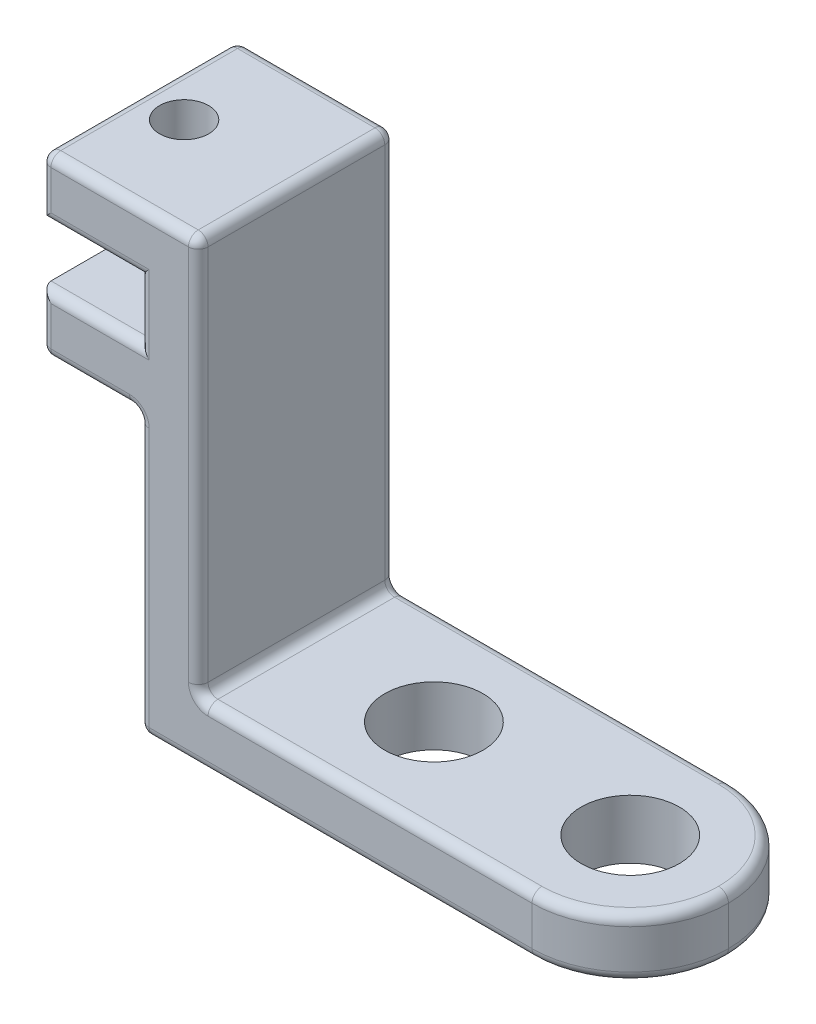
from build123d import *

# Parameters (mm, degrees)
BOSS_EXTRUDE1_DEPTH = 10
SKETCH2_R           = 1.25
CUT_EXTRUDE1_DEPTH  = 40.220402854
CUT_EXTRUDE2_REACH  = 39.524
SKETCH3_R           = 2.5
FILLET1_R           = 0.5
FILLET2_R           = 5


with BuildPart() as part:
    # Sketch1 → Boss-Extrude1 (new body)
    with BuildSketch(Plane.XY):
        Polygon((0, 0), (8, 0), (8, -20.2), (30, -20.2), (30, -23.2), (5, -23.2), (5, -9), (0, -9), (0, -6), (5, -6), (5, -3), (0, -3), align=None)
    extrude(amount=BOSS_EXTRUDE1_DEPTH)

    # Sketch2 → Cut-Extrude1 (cut, through all)
    with BuildSketch(Plane(origin=(0, 0, 0), x_dir=(1, 0, 0), z_dir=(0, 1, 0))):
        with Locations(Location((2.28, -5, 0), (0, 0, 270))):
            Circle(SKETCH2_R)
    extrude(amount=-CUT_EXTRUDE1_DEPTH, mode=Mode.SUBTRACT)

    # Sketch3 → Cut-Extrude2 (cut, up to next)
    with BuildSketch(Plane(origin=(0, -20.2, 0), x_dir=(1, 0, 0), z_dir=(0, 1, 0)), mode=Mode.PRIVATE) as cut_extrude2_sk1:
        with Locations(Location((25, -5, 0), (0, 0, 270))):
            Circle(SKETCH3_R)
    cut_extrude2_tool1 = extrude(cut_extrude2_sk1.sketch, amount=-CUT_EXTRUDE2_REACH, mode=Mode.PRIVATE) & part.part
    # Sketch3 → Cut-Extrude2 (cut, up to next)
    with BuildSketch(Plane(origin=(0, -20.2, 0), x_dir=(1, 0, 0), z_dir=(0, 1, 0)), mode=Mode.PRIVATE) as cut_extrude2_sk2:
        with Locations(Location((15, -5, 0), (0, 0, 270))):
            Circle(SKETCH3_R)
    cut_extrude2_tool2 = extrude(cut_extrude2_sk2.sketch, amount=-CUT_EXTRUDE2_REACH, mode=Mode.PRIVATE) & part.part
    add(cut_extrude2_tool1.solids().sort_by_distance((25, -20.2, 5))[0], mode=Mode.SUBTRACT)
    add(cut_extrude2_tool2.solids().sort_by_distance((15, -20.2, 5))[0], mode=Mode.SUBTRACT)

    # Fillet1
    fillet1_edges = [part.edges().sort_by_distance(p)[0] for p in [
        (4, 0, 0),
        (8, -10.1, 0),
        (5, -4.5, 10),
        (19, -20.2, 0),
        (17.5, -23.2, 0),
        (5, -16.1, 0),
        (2.5, -9, 0),
        (0, -7.5, 0),
        (2.5, -6, 0),
        (5, -4.5, 0),
        (2.5, -3, 0),
        (0, -1.5, 0),
        (2.5, -6, 10),
        (0, 0, 5),
        (8, 0, 5),
        (8, -20.2, 5),
        (0, -7.5, 10),
        (30, -20.2, 5),
        (30, -23.2, 5),
        (5, -23.2, 5),
        (5, -9, 5),
        (0, -9, 5),
        (2.5, -9, 10),
        (5, -16.1, 10),
        (17.5, -23.2, 10),
        (19, -20.2, 10),
        (8, -10.1, 10),
        (4, 0, 10),
        (0, -1.5, 10),
        (2.5, -3, 10),
    ]]
    fillet(fillet1_edges, radius=FILLET1_R)

    # Fillet2
    # the kernel refuses this fillet: 5 mm, written as the material it takes off along each edge
    with BuildSketch(Plane(origin=(25, -20.2, 5), x_dir=(1, 0, 0), z_dir=(0, 0, 1))) as fillet2_piece_1:
        with BuildLine():
            CenterArc((4.5, -0.5), 0.5, 0, 90)
            Line((5, -0.5), (5, 0))
            Line((5, 0), (4.5, 0))
        make_face()
    revolve(axis=Axis((25, -20.2, 5), (0, 1, 0)), revolution_arc=90, mode=Mode.SUBTRACT)
    with BuildSketch(Plane(origin=(25, -23.2, 5), x_dir=(0, 0, -1), z_dir=(-1, 0, 0))) as fillet2_piece_2:
        with BuildLine():
            CenterArc((4.5, -0.5), 0.5, 0, 90)
            Line((5, -0.5), (5, 0))
            Line((5, 0), (4.5, 0))
        make_face()
    revolve(axis=Axis((25, -23.2, 5), (0, -1, 0)), revolution_arc=90, mode=Mode.SUBTRACT)
    with BuildSketch(Plane(origin=(25, -20.2, 5), x_dir=(0, 0, 1), z_dir=(-1, 0, 0))) as fillet2_piece_3:
        with BuildLine():
            CenterArc((4.5, -0.5), 0.5, 0, 90)
            Line((5, -0.5), (5, 0))
            Line((5, 0), (4.5, 0))
        make_face()
    revolve(axis=Axis((25, -20.2, 5), (0, 1, 0)), revolution_arc=90, mode=Mode.SUBTRACT)
    with BuildSketch(Plane(origin=(25, -23.2, 5), x_dir=(1, 0, 0), z_dir=(0, 0, -1))) as fillet2_piece_4:
        with BuildLine():
            CenterArc((4.5, -0.5), 0.5, 0, 90)
            Line((5, -0.5), (5, 0))
            Line((5, 0), (4.5, 0))
        make_face()
    revolve(axis=Axis((25, -23.2, 5), (0, -1, 0)), revolution_arc=90, mode=Mode.SUBTRACT)
    with BuildSketch(Plane(origin=(30, -20.2, 10), x_dir=(-1, 0, 0), z_dir=(0, -1, 0))) as fillet2_piece_5:
        with BuildLine():
            CenterArc((FILLET2_R, FILLET2_R), FILLET2_R, 180, 90)
            Line((0, FILLET2_R), (0, 0))
            Line((0, 0), (FILLET2_R, 0))
        make_face()
    extrude(amount=3, mode=Mode.SUBTRACT)
    with BuildSketch(Plane(origin=(30, -20.2, 0), x_dir=(-1, 0, 0), z_dir=(0, -1, 0))) as fillet2_piece_6:
        with BuildLine():
            CenterArc((FILLET2_R, -FILLET2_R), FILLET2_R, 90, 90)
            Line((0, -FILLET2_R), (0, 0))
            Line((0, 0), (FILLET2_R, 0))
        make_face()
    extrude(amount=3, mode=Mode.SUBTRACT)


solid = part.part
